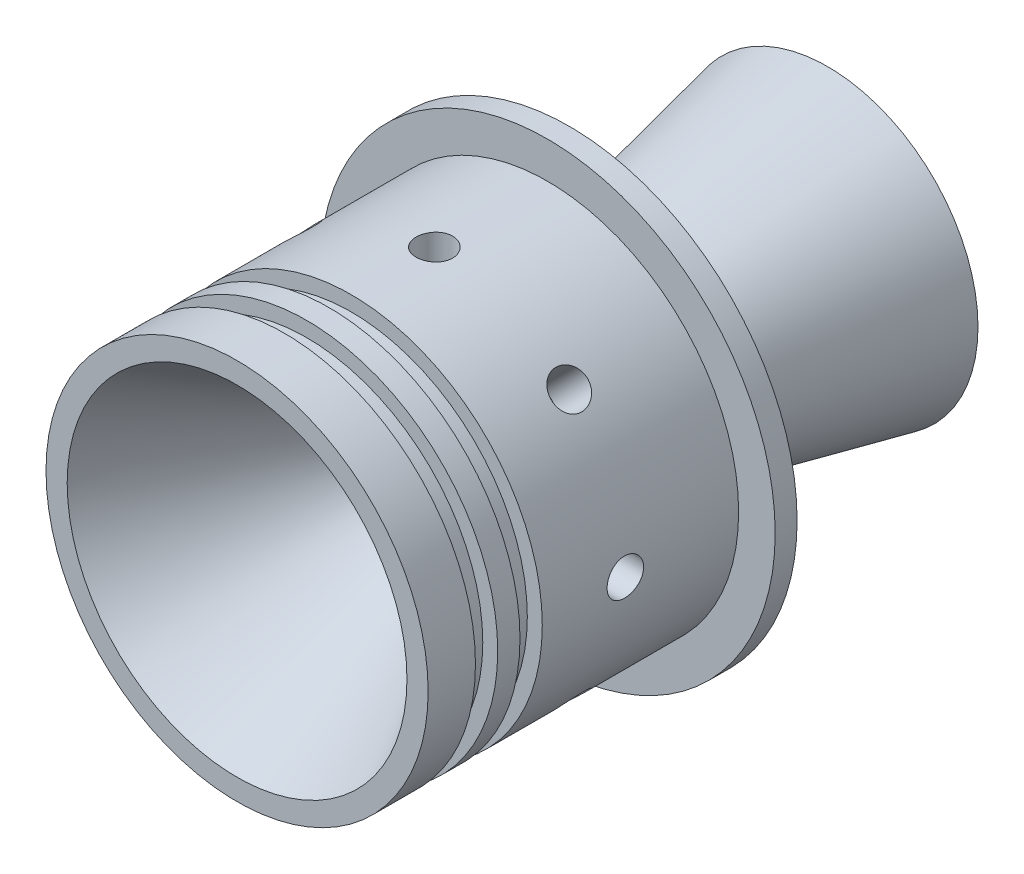
from build123d import *

# Parameters (mm, degrees)
MATRIZC1_COUNT = 8


with BuildPart() as part:
    # Croquis2 → Revolución1 (revolve)
    with BuildSketch(Plane(origin=(0, 0, 0), x_dir=(0, 0, -1), z_dir=(1, 0, 0))):
        Polygon((0, 23.2509), (28.49379463, 6.8), (30.49379463, 6.8), (80.833336802, 17.5), (80.833336802, 20.567021785), (45.49379463, 13.05537021), (45.49379463, 26.1493), (45.49379463, 31.1493), (42.49379463, 31.1493), (42.49379463, 26.1493), (15.62, 26.1493), (15.62, 24.104408282), (12.572, 24.104408282), (12.572, 26.1493), (9.524, 26.1493), (9.524, 24.104408282), (6.476, 24.104408282), (6.476, 26.1493), (0, 26.1493), align=None)
    revolve(axis=Axis((0, 0, 14.017218159), (0, 0, -1)))

    # Croquis5 → Ø5.0mm Dowel Hole1 (revolve, cut)
    with BuildSketch(Plane(origin=(0, 26.1493, -26.99379463), x_dir=(0, 0, 1), z_dir=(1, 0, 0))):
        Polygon((0, 0), (0, 8.502151548), (2.5, 7), (2.5, 0), align=None)
    f_5_0mm_dowel_hole1 = revolve(axis=Axis((0, 32.4993, -26.99379463), (0, -1, 0)), mode=Mode.SUBTRACT)

    # MatrizC1: Ø5.0mm Dowel Hole1 ×8 about axis
    matrizc1_axis = Axis((0, 0, -15.62), (0, 0, 1))
    for i in range(1, MATRIZC1_COUNT):
        add(f_5_0mm_dowel_hole1.rotate(matrizc1_axis, i * 360 / MATRIZC1_COUNT), mode=Mode.SUBTRACT)


solid = part.part
